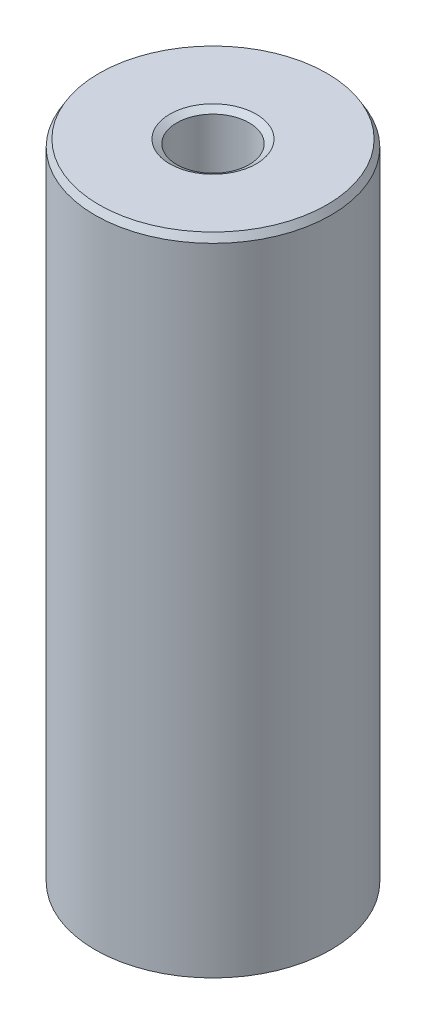
from build123d import *
from OCP.BRepFilletAPI import BRepFilletAPI_MakeChamfer

# Parameters (mm, degrees)
SKETCH1_R           = 5
BOSS_EXTRUDE1_DEPTH = 27.431560341
SKETCH2_R           = 1.535384671
CUT_EXTRUDE1_DEPTH  = 29.32826332
CHAMFER1_SIZE       = 0.294813991
CHAMFER1_SIZE2      = 0.170210937


with BuildPart() as part:
    # Sketch1 → Boss-Extrude1 (new body)
    with BuildSketch(Plane(origin=(0, 0, 0), x_dir=(1, 0, 0), z_dir=(0, 1, 0))):
        Circle(SKETCH1_R)
    extrude(amount=BOSS_EXTRUDE1_DEPTH)

    # Sketch2 → Cut-Extrude1 (cut, through all)
    with BuildSketch(Plane(origin=(0, 0, 0), x_dir=(1, 0, 0), z_dir=(0, 1, 0))):
        Circle(SKETCH2_R)
    extrude(amount=CUT_EXTRUDE1_DEPTH, mode=Mode.SUBTRACT)

    # Chamfer1: one chamfer whose edges measure the first distance from different faces: ONE call of the kernel's chamfer builder (chamfer() names one face for all edges)
    chamfer1_edges_1 = [part.edges().sort_by_distance(p)[0] for p in [
        (-1.535384671, 27.431560341, 0),
    ]]
    chamfer1_side_1 = [part.faces().sort_by_distance(p)[0] for p in [
        (-4.858578644, 27.431560341, 0),
    ]]
    chamfer1_edges_2 = [part.edges().sort_by_distance(p)[0] for p in [
        (-1.535384671, 0, 0),
    ]]
    chamfer1_side_2 = [part.faces().sort_by_distance(p)[0] for p in [
        (-1.535384671, 13.715780171, 0),
    ]]
    chamfer1_edges_3 = [part.edges().sort_by_distance(p)[0] for p in [
        (-5, 0, 0),
    ]]
    chamfer1_side_3 = [part.faces().sort_by_distance(p)[0] for p in [
        (-4.858578644, 0, 0),
    ]]
    chamfer1_edges_4 = [part.edges().sort_by_distance(p)[0] for p in [
        (-5, 27.431560341, 0),
    ]]
    chamfer1_side_4 = [part.faces().sort_by_distance(p)[0] for p in [
        (-5, 13.715780171, 0),
    ]]
    chamfer1 = BRepFilletAPI_MakeChamfer(part.part.solid().wrapped)
    for e in chamfer1_edges_1:
        chamfer1.Add(CHAMFER1_SIZE, CHAMFER1_SIZE2, e.wrapped, chamfer1_side_1[0].wrapped)  # the first distance lies on this face
    for e in chamfer1_edges_2:
        chamfer1.Add(CHAMFER1_SIZE, CHAMFER1_SIZE2, e.wrapped, chamfer1_side_2[0].wrapped)  # the first distance lies on this face
    for e in chamfer1_edges_3:
        chamfer1.Add(CHAMFER1_SIZE, CHAMFER1_SIZE2, e.wrapped, chamfer1_side_3[0].wrapped)  # the first distance lies on this face
    for e in chamfer1_edges_4:
        chamfer1.Add(CHAMFER1_SIZE, CHAMFER1_SIZE2, e.wrapped, chamfer1_side_4[0].wrapped)  # the first distance lies on this face
    add(Compound.cast(chamfer1.Shape()), mode=Mode.REPLACE)


solid = part.part
